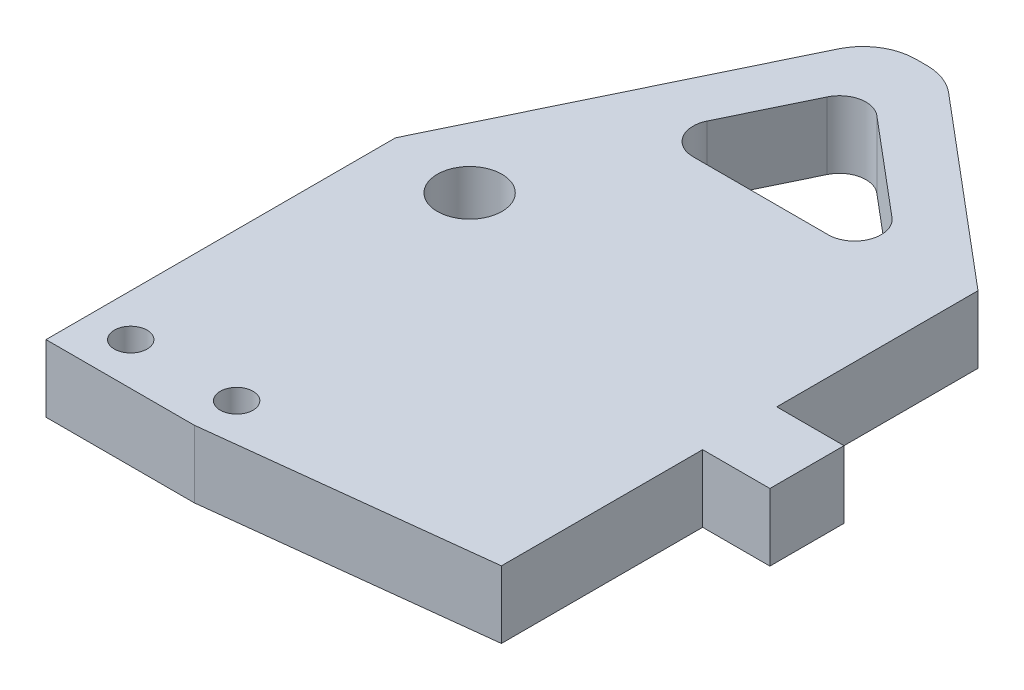
from build123d import *

# Parameters (mm, degrees)
SKETCH1_R           = 6.1
SKETCH1_R_2         = 3.1
BOSS_EXTRUDE1_DEPTH = 12.7
FILLET1_R           = 10
CUT_EXTRUDE1_DEPTH  = 147.442104601
FILLET2_R           = 5


with BuildPart() as part:
    # Sketch1 → Boss-Extrude1 (new body)
    with BuildSketch(Plane(origin=(0, 0, 0), x_dir=(1, 0, 0), z_dir=(0, 1, 0))):
        Polygon((-80, 0), (-80, 60), (-50, 122), (-38, 122), (0, 90), (0, 52), (12.7, 52), (12.7, 38), (0, 38), (0, 0), (-52, -6), (-80, -6), align=None)
        with Locations((-64, 58)):
            Circle(SKETCH1_R, mode=Mode.SUBTRACT)
        with Locations((-72, 2)):
            Circle(SKETCH1_R_2, mode=Mode.SUBTRACT)
        with Locations((-52, 2)):
            Circle(SKETCH1_R_2, mode=Mode.SUBTRACT)
    extrude(amount=BOSS_EXTRUDE1_DEPTH)

    # Fillet1
    fillet1_edges = [part.edges().sort_by_distance(p)[0] for p in [
        (-38, 6.35, -122),
        (-50, 6.35, -122),
    ]]
    fillet(fillet1_edges, radius=FILLET1_R)

    # Sketch3 → Cut-Extrude1 (cut, through all)
    with BuildSketch(Plane(origin=(0, 12.7, 0), x_dir=(1, 0, 0), z_dir=(0, 1, 0))):
        Polygon((-9.587177935, 85), (-43.127425897, 113.244419336), (-56.794080414, 85), align=None)
    extrude(amount=-CUT_EXTRUDE1_DEPTH, mode=Mode.SUBTRACT)

    # Fillet2
    fillet2_edges = [part.edges().sort_by_distance(p)[0] for p in [
        (-43.127425897, 6.35, -113.244419336),
        (-9.587177935, 6.35, -85),
        (-56.794080414, 6.35, -85),
    ]]
    fillet(fillet2_edges, radius=FILLET2_R)


solid = part.part
